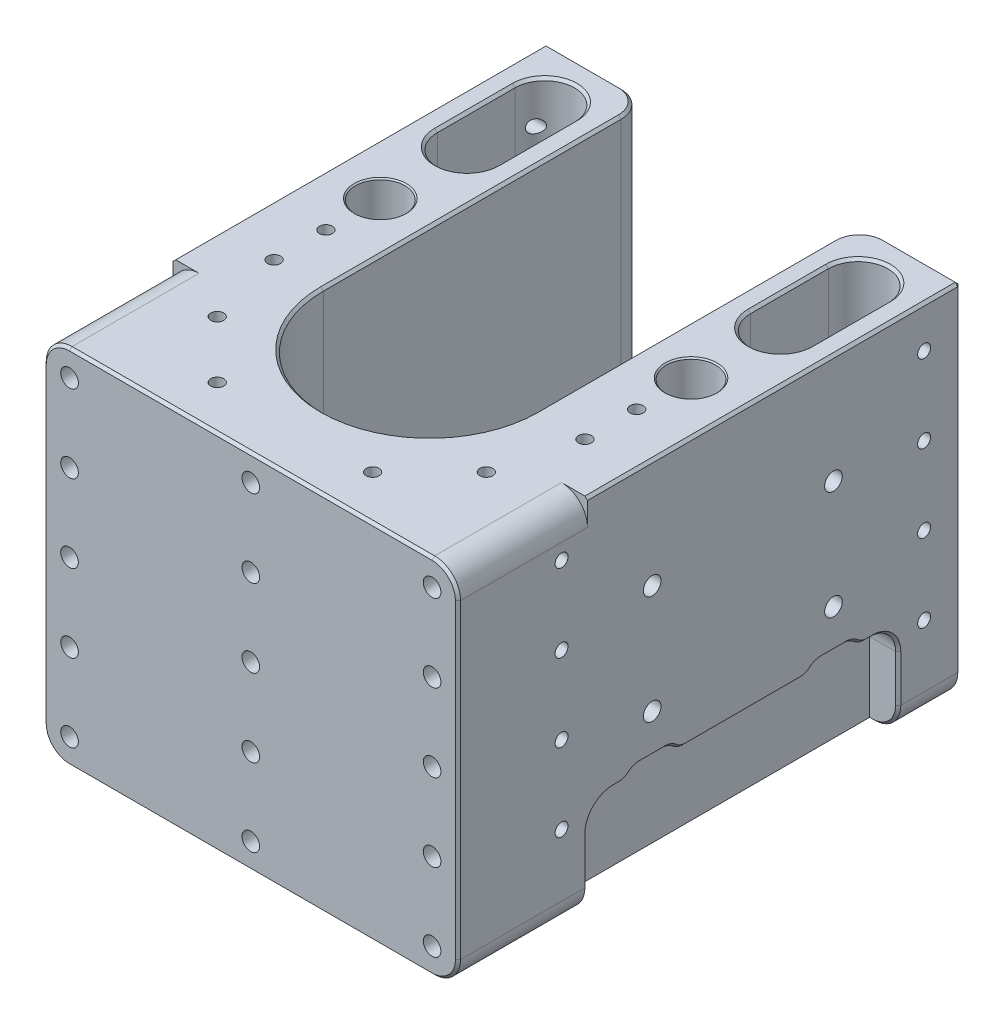
from build123d import *

# Parameters (mm, degrees)
BOSS_EXTRUDE1_DEPTH             = 140
SKETCH3_R                       = 9.55
CUT_EXTRUDE2_DEPTH              = 14.326
M8X1_25_TAPPED_HOLE1_AT_2_COUNT = 2
M8X1_25_TAPPED_HOLE1_AT_2_PITCH = 70
M8X1_25_TAPPED_HOLE1_AT_3_COUNT = 2
M8X1_25_TAPPED_HOLE1_AT_3_PITCH = 81.633326528
M8X1_25_TAPPED_HOLE1_AT_4_COUNT = 2
M8X1_25_TAPPED_HOLE1_AT_4_PITCH = 42
FILLET1_R                       = 10
SKETCH36_W                      = 33.761991249
SKETCH36_H                      = 120
SKETCH36_W_2                    = 53.52949171
CUT_EXTRUDE3_DEPTH              = 38
CBORE_FOR_M8_SHCS1_D            = 9
CBORE_FOR_M8_SHCS1_CBORE_D      = 15
CBORE_FOR_M8_SHCS1_CBORE_DEPTH  = 9
CHAMFER7_SIZE                   = 0.5
CHAMFER11_SIZE                  = 1
CHAMFER12_SIZE                  = 0.5
M6X1_0_TAPPED_HOLE1_D           = 5
M6X1_0_TAPPED_HOLE1_DEPTH       = 15
M6X1_0_TAPPED_HOLE1_CSINK_D     = 6.05
M6X1_0_TAPPED_HOLE1_CSINK_ANGLE = 90
M6X1_0_TAPPED_HOLE1_TIP         = 1.502151548
CUT_EXTRUDE4_DEPTH              = 25
FILLET2_R                       = 10
CUT_EXTRUDE5_DEPTH              = 50
FILLET3_R                       = 10
CHAMFER3_SIZE                   = 1
CHAMFER15_SIZE                  = 1
SKETCH55_W                      = 20
SKETCH55_H                      = 3
CUT_EXTRUDE6_DEPTH              = 227.296265988
FILLET4_R                       = 6
FILLET5_R                       = 6
CHAMFER16_SIZE                  = 1
M8X1_25_TAPPED_HOLE4_D          = 6.8
M8X1_25_TAPPED_HOLE4_DEPTH      = 20
M8X1_25_TAPPED_HOLE4_TIP        = 2.042926105
M6X1_0_TAPPED_HOLE2_D           = 5
M6X1_0_TAPPED_HOLE2_DEPTH       = 17
M6X1_0_TAPPED_HOLE2_TIP         = 1.502151548
M6X1_0_TAPPED_HOLE3_AT_2_COUNT  = 2
M6X1_0_TAPPED_HOLE3_AT_2_PITCH  = 30
M6X1_0_TAPPED_HOLE3_AT_3_COUNT  = 2
M6X1_0_TAPPED_HOLE3_AT_3_PITCH  = 60
M6X1_0_TAPPED_HOLE3_AT_4_COUNT  = 2
M6X1_0_TAPPED_HOLE3_AT_4_PITCH  = 90
M6X1_0_TAPPED_HOLE3_AT_5_COUNT  = 2
M6X1_0_TAPPED_HOLE3_AT_5_PITCH  = 140
M6X1_0_TAPPED_HOLE3_AT_6_COUNT  = 2
M6X1_0_TAPPED_HOLE3_AT_6_PITCH  = 143.178210633
M6X1_0_TAPPED_HOLE3_AT_7_COUNT  = 2
M6X1_0_TAPPED_HOLE3_AT_7_PITCH  = 152.315462117
M6X1_0_TAPPED_HOLE3_AT_8_COUNT  = 2
M6X1_0_TAPPED_HOLE3_AT_8_PITCH  = 166.433169771


# Read off the part's stored shape, not the designer's step: M8x1.25 Tapped Hole3
with BuildPart() as part:
    # Sketch1 → Boss-Extrude1 (new body)
    with BuildSketch(Plane(origin=(0, 0, 0), x_dir=(1, 0, 0), z_dir=(0, 1, 0))):
        with BuildLine():
            Line((41, 97), (80, 97))
            Line((80, 97), (80, -97))
            Line((80, -97), (-80, -97))
            Line((-80, -97), (-80, 97))
            Line((-80, 97), (-41, 97))
            Line((-41, 97), (-41, -28))
            ThreePointArc((-41, -28), (0, -69), (41, -28))
            Line((41, -28), (41, 97))
        make_face()
    extrude(amount=BOSS_EXTRUDE1_DEPTH)

    # Sketch3 → Cut-Extrude2 (cut)
    with BuildSketch(Plane(origin=(0, 140, 0), x_dir=(1, 0, 0), z_dir=(0, 1, 0))):
        with Locations(Location((-60, 13, 0), (0, 0, 270))):
            Circle(SKETCH3_R)
        with Locations(Location((60, 13, 0), (0, 0, 270))):
            Circle(SKETCH3_R)
    extrude(amount=-CUT_EXTRUDE2_DEPTH, mode=Mode.SUBTRACT)

    # Sketch10 → M8x1.25 Tapped Hole1 (revolve, cut)
    with BuildSketch(Plane(origin=(80, 56, -48), x_dir=(0, 0, -1), z_dir=(0, 1, 0))):
        Polygon((0, 0), (0, 32.042926105), (3.4, 30), (3.4, 0), align=None)
    m8x1_25_tapped_hole1 = revolve(axis=Axis((86.35, 56, -48), (-1, 0, 0)), mode=Mode.SUBTRACT)

    # M8x1.25 Tapped Hole1 at 2: M8x1.25 Tapped Hole1 ×2
    with Locations(*[(0, 0, i * M8X1_25_TAPPED_HOLE1_AT_2_PITCH) for i in range(1, M8X1_25_TAPPED_HOLE1_AT_2_COUNT)]):
        add(m8x1_25_tapped_hole1, mode=Mode.SUBTRACT)

    # M8x1.25 Tapped Hole1 at 3: M8x1.25 Tapped Hole1 ×2
    with Locations(*[Vector(0, 0.5144957554275263, 0.8574929257125443) * (i * M8X1_25_TAPPED_HOLE1_AT_3_PITCH) for i in range(1, M8X1_25_TAPPED_HOLE1_AT_3_COUNT)]):
        add(m8x1_25_tapped_hole1, mode=Mode.SUBTRACT)

    # M8x1.25 Tapped Hole1 at 4: M8x1.25 Tapped Hole1 ×2
    with Locations(*[(0, i * M8X1_25_TAPPED_HOLE1_AT_4_PITCH, 0) for i in range(1, M8X1_25_TAPPED_HOLE1_AT_4_COUNT)]):
        add(m8x1_25_tapped_hole1, mode=Mode.SUBTRACT)

    # Mirror2: M8x1.25 Tapped Hole1 across plane
    add(m8x1_25_tapped_hole1.mirror(Plane(origin=(0, 0, 0), x_dir=(0, 0, 1), z_dir=(1, 0, 0))), mode=Mode.SUBTRACT)

    # Mirror2 copy 1 sketch → Mirror2 copy 1 (revolve, cut)
    with BuildSketch(Plane(origin=(-80, 56, 22), x_dir=(0, 0, -1), z_dir=(0, 1, 0))):
        Polygon((0, 0), (0, -32.042926105), (3.4, -30), (3.4, 0), align=None)
    revolve(axis=Axis((-86.35, 56, 22), (-1, 0, 0)), mode=Mode.SUBTRACT)

    # Mirror2 copy 2 sketch → Mirror2 copy 2 (revolve, cut)
    with BuildSketch(Plane(origin=(-80, 98, 22), x_dir=(0, 0, -1), z_dir=(0, 1, 0))):
        Polygon((0, 0), (0, -32.042926105), (3.4, -30), (3.4, 0), align=None)
    revolve(axis=Axis((-86.35, 98, 22), (-1, 0, 0)), mode=Mode.SUBTRACT)

    # Mirror2 copy 3 sketch → Mirror2 copy 3 (revolve, cut)
    with BuildSketch(Plane(origin=(-80, 98, -48), x_dir=(0, 0, -1), z_dir=(0, 1, 0))):
        Polygon((0, 0), (0, -32.042926105), (3.4, -30), (3.4, 0), align=None)
    revolve(axis=Axis((-86.35, 98, -48), (-1, 0, 0)), mode=Mode.SUBTRACT)

    # Fillet1
    fillet1_edges = [part.edges().sort_by_distance(p)[0] for p in [
        (-41, 70, -97),
        (41, 70, -97),
    ]]
    fillet(fillet1_edges, radius=FILLET1_R)

    # Sketch36 → Cut-Extrude3 (cut)
    with BuildSketch(Plane(origin=(0, 0, 0), x_dir=(1, 0, 0), z_dir=(0, 1, 0))):
        with Locations((-85.880995625, 13)):
            Rectangle(SKETCH36_W, SKETCH36_H)
        with Locations((95.764745855, 13)):
            Rectangle(SKETCH36_W_2, SKETCH36_H)
    extrude(amount=CUT_EXTRUDE3_DEPTH, mode=Mode.SUBTRACT)

    # CBORE for M8 SHCS1 (through all)
    with Locations(Plane(origin=(0, 0, 0), x_dir=(-1, 0, 0), z_dir=(0, -1, 0))):
        with Locations((60, 13), (-60, 13)):
            CounterBoreHole(CBORE_FOR_M8_SHCS1_D / 2, CBORE_FOR_M8_SHCS1_CBORE_D / 2, CBORE_FOR_M8_SHCS1_CBORE_DEPTH)

    # Chamfer7
    chamfer7_edges = [part.edges().sort_by_distance(p)[0] for p in [
        (-60, 140, -22.55),
        (60, 140, -22.55),
    ]]
    chamfer(chamfer7_edges, length=CHAMFER7_SIZE)

    # Chamfer11
    chamfer11_edges = [part.edges().sort_by_distance(p)[0] for p in [
        (67.5, 0, -13),
        (-52.5, 0, -13),
    ]]
    chamfer(chamfer11_edges, length=CHAMFER11_SIZE)

    # Chamfer12
    chamfer12_edges = [part.edges().sort_by_distance(p)[0] for p in [
        (55.5, 125.674, -13),
        (55.5, 9, -13),
        (-64.5, 125.674, -13),
        (-64.5, 9, -13),
    ]]
    chamfer(chamfer12_edges, length=CHAMFER12_SIZE)

    # M8x1.25 Tapped Hole3 outline → M8x1.25 Tapped Hole3 (revolve, cut)
    with BuildSketch(Plane(origin=(-54, 0, 62.5), x_dir=(1, 0, 0), z_dir=(0, 0, 1))):
        Polygon((3.4, 20), (0, 22.042926105), (0, 0), (4.3, 0), (3.4, 0.9), align=None)
    revolve(axis=Axis((-54, 0, 62.5), (0, 1, 0)), mode=Mode.SUBTRACT)

    # M8x1.25 Tapped Hole3 2 outline → M8x1.25 Tapped Hole3 2 (revolve, cut)
    with BuildSketch(Plane(origin=(54, 0, 62.5), x_dir=(1, 0, 0), z_dir=(0, 0, 1))):
        Polygon((3.4, 20), (0, 22.042926105), (0, 0), (4.3, 0), (3.4, 0.9), align=None)
    revolve(axis=Axis((54, 0, 62.5), (0, 1, 0)), mode=Mode.SUBTRACT)

    # M8x1.25 Tapped Hole3 3 outline → M8x1.25 Tapped Hole3 3 (revolve, cut)
    with BuildSketch(Plane(origin=(54, 0, 32.5), x_dir=(1, 0, 0), z_dir=(0, 0, 1))):
        Polygon((3.4, 20), (0, 22.042926105), (0, 0), (4.3, 0), (3.4, 0.9), align=None)
    revolve(axis=Axis((54, 0, 32.5), (0, 1, 0)), mode=Mode.SUBTRACT)

    # M8x1.25 Tapped Hole3 4 outline → M8x1.25 Tapped Hole3 4 (revolve, cut)
    with BuildSketch(Plane(origin=(54, 0, 2.5), x_dir=(1, 0, 0), z_dir=(0, 0, 1))):
        Polygon((3.4, 20), (0, 22.042926105), (0, 0), (4.3, 0), (3.4, 0.9), align=None)
    revolve(axis=Axis((54, 0, 2.5), (0, 1, 0)), mode=Mode.SUBTRACT)

    # M8x1.25 Tapped Hole3 5 outline → M8x1.25 Tapped Hole3 5 (revolve, cut)
    with BuildSketch(Plane(origin=(54, 0, -27.5), x_dir=(1, 0, 0), z_dir=(0, 0, 1))):
        Polygon((3.4, 20), (0, 22.042926105), (0, 0), (4.3, 0), (3.4, 0.9), align=None)
    revolve(axis=Axis((54, 0, -27.5), (0, 1, 0)), mode=Mode.SUBTRACT)

    # M8x1.25 Tapped Hole3 6 outline → M8x1.25 Tapped Hole3 6 (revolve, cut)
    with BuildSketch(Plane(origin=(54, 0, -57.5), x_dir=(1, 0, 0), z_dir=(0, 0, 1))):
        Polygon((3.4, 20), (0, 22.042926105), (0, 0), (4.3, 0), (3.4, 0.9), align=None)
    revolve(axis=Axis((54, 0, -57.5), (0, 1, 0)), mode=Mode.SUBTRACT)

    # M8x1.25 Tapped Hole3 7 outline → M8x1.25 Tapped Hole3 7 (revolve, cut)
    with BuildSketch(Plane(origin=(-54, 0, 32.5), x_dir=(1, 0, 0), z_dir=(0, 0, 1))):
        Polygon((3.4, 20), (0, 22.042926105), (0, 0), (4.3, 0), (3.4, 0.9), align=None)
    revolve(axis=Axis((-54, 0, 32.5), (0, 1, 0)), mode=Mode.SUBTRACT)

    # M8x1.25 Tapped Hole3 8 outline → M8x1.25 Tapped Hole3 8 (revolve, cut)
    with BuildSketch(Plane(origin=(-54, 0, 2.5), x_dir=(1, 0, 0), z_dir=(0, 0, 1))):
        Polygon((3.4, 20), (0, 22.042926105), (0, 0), (4.3, 0), (3.4, 0.9), align=None)
    revolve(axis=Axis((-54, 0, 2.5), (0, 1, 0)), mode=Mode.SUBTRACT)

    # M8x1.25 Tapped Hole3 9 outline → M8x1.25 Tapped Hole3 9 (revolve, cut)
    with BuildSketch(Plane(origin=(-54, 0, -27.5), x_dir=(1, 0, 0), z_dir=(0, 0, 1))):
        Polygon((3.4, 20), (0, 22.042926105), (0, 0), (4.3, 0), (3.4, 0.9), align=None)
    revolve(axis=Axis((-54, 0, -27.5), (0, 1, 0)), mode=Mode.SUBTRACT)

    # M8x1.25 Tapped Hole3 10 outline → M8x1.25 Tapped Hole3 10 (revolve, cut)
    with BuildSketch(Plane(origin=(-54, 0, -57.5), x_dir=(1, 0, 0), z_dir=(0, 0, 1))):
        Polygon((3.4, 20), (0, 22.042926105), (0, 0), (4.3, 0), (3.4, 0.9), align=None)
    revolve(axis=Axis((-54, 0, -57.5), (0, 1, 0)), mode=Mode.SUBTRACT)

    # M6x1.0 Tapped Hole1
    with Locations(Plane(origin=(0, 0, 0), x_dir=(-1, 0, 0), z_dir=(0, -1, 0))):
        with Locations((-60, -85), (-20, -85), (20, -85), (60, -85)):
            CounterSinkHole(M6X1_0_TAPPED_HOLE1_D / 2, M6X1_0_TAPPED_HOLE1_CSINK_D / 2, depth=M6X1_0_TAPPED_HOLE1_DEPTH, counter_sink_angle=M6X1_0_TAPPED_HOLE1_CSINK_ANGLE)
            with Locations((0, 0, -(M6X1_0_TAPPED_HOLE1_DEPTH + M6X1_0_TAPPED_HOLE1_TIP / 2))):  # 118° drill point
                Cone(0, M6X1_0_TAPPED_HOLE1_D / 2, M6X1_0_TAPPED_HOLE1_TIP, mode=Mode.SUBTRACT)

    # Sketch45 → Cut-Extrude4 (cut)
    with BuildSketch(Plane(origin=(0, 140, 0), x_dir=(1, 0, 0), z_dir=(0, 1, 0))):
        with BuildLine():
            Line((-72, 47), (-72, 77))
            ThreePointArc((-72, 77), (-60.5, 88.5), (-49, 77))
            Line((-49, 77), (-49, 47))
            ThreePointArc((-49, 47), (-60.5, 35.5), (-72, 47))
        make_face()
    cut_extrude4 = extrude(amount=-CUT_EXTRUDE4_DEPTH, mode=Mode.SUBTRACT)

    # Mirror3: Cut-Extrude4 across plane
    add(cut_extrude4.mirror(Plane(origin=(0, 0, 0), x_dir=(0, 0, 1), z_dir=(1, 0, 0))), mode=Mode.SUBTRACT)

    # Fillet2
    fillet2_edges = [part.edges().sort_by_distance(p)[0] for p in [
        (74.5, 38, -73),
        (74.5, 38, 47),
        (-74.5, 38, -73),
        (-74.5, 38, 47),
    ]]
    fillet(fillet2_edges, radius=FILLET2_R)

    # Sketch46 → Cut-Extrude5 (cut)
    with BuildSketch(Plane.XY.offset(97)):
        with BuildLine():
            Line((70, 140), (80, 140))
            Line((80, 140), (80, 130))
            ThreePointArc((80, 130), (77.071067812, 137.071067812), (70, 140))
        make_face()
    cut_extrude5 = extrude(amount=-CUT_EXTRUDE5_DEPTH, mode=Mode.SUBTRACT)

    # Mirror4: Cut-Extrude5 across plane
    add(cut_extrude5.mirror(Plane(origin=(0, 0, 0), x_dir=(0, 0, 1), z_dir=(1, 0, 0))), mode=Mode.SUBTRACT)

    # Fillet3
    fillet3_edges = [part.edges().sort_by_distance(p)[0] for p in [
        (80, 0, 72),
        (80, 0, -85),
        (-80, 0, 72),
        (-80, 0, -85),
    ]]
    fillet(fillet3_edges, radius=FILLET3_R)

    # Chamfer3
    chamfer3_edges = [part.edges().sort_by_distance(p)[0] for p in [
        (0, 0, 69),
        (-80, 75, -97),
        (80, 75, -97),
        (0, 140, 69),
        (-41, 140, -29.5),
        (-80, 140, -25),
        (80, 70, 97),
        (80, 140, -25),
        (77.071067812, 137.071067812, 97),
        (0, 140, 97),
        (-80, 70, 97),
        (-77.071067812, 137.071067812, 97),
        (60.5, 0, -97),
        (0, 0, 97),
        (-77.071067812, 2.928932188, -97),
        (77.071067812, 2.928932188, -97),
        (-77.071067812, 2.928932188, 97),
        (77.071067812, 2.928932188, 97),
        (41, 0, -29.5),
        (41, 140, -29.5),
        (-60.5, 0, -97),
        (-43.928932188, 0, -94.071067812),
        (43.928932188, 0, -94.071067812),
        (-65.5, 140, -97),
        (-43.928932188, 140, -94.071067812),
        (43.928932188, 140, -94.071067812),
        (65.5, 140, -97),
        (-41, 0, -29.5),
    ]]
    chamfer(chamfer3_edges, length=CHAMFER3_SIZE)

    # Chamfer15
    chamfer15_edges = [part.edges().sort_by_distance(p)[0] for p in [
        (-60.5, 140, -35.5),
        (-49, 140, -62),
        (-60.5, 140, -88.5),
        (-72, 140, -62),
        (60.5, 140, -35.5),
        (49, 140, -62),
        (60.5, 140, -88.5),
        (72, 140, -62),
    ]]
    chamfer(chamfer15_edges, length=CHAMFER15_SIZE)

    # Sketch55 → Cut-Extrude6 (cut, through all)
    with BuildSketch(Plane(origin=(69, 0, 0), x_dir=(0, 0, -1), z_dir=(1, 0, 0))):
        with Locations((-22, 39.5)):
            Rectangle(SKETCH55_W, SKETCH55_H)
        with Locations((48, 39.5)):
            Rectangle(SKETCH55_W, SKETCH55_H)
    cut_extrude6 = extrude(amount=CUT_EXTRUDE6_DEPTH, mode=Mode.SUBTRACT)

    # Mirror6: Cut-Extrude6 across plane
    add(cut_extrude6.mirror(Plane(origin=(0, 0, 0), x_dir=(0, 0, 1), z_dir=(1, 0, 0))), mode=Mode.SUBTRACT)

    # Fillet4
    # the kernel refuses this fillet: 6 mm, written as the material it adds along each edge
    with BuildSketch(Plane(origin=(56.009618943, 41, -58), x_dir=(0, -1, 0), z_dir=(1, 0, 0)), Plane(origin=(56.009618943, 41, 12), x_dir=(0, -1, 0), z_dir=(1, 0, 0)), Plane(origin=(-56.009618943, 41, -38), x_dir=(0, -1, 0), z_dir=(-1, 0, 0)), Plane(origin=(-56.009618943, 41, 32), x_dir=(0, -1, 0), z_dir=(-1, 0, 0))) as fillet4_piece_1:
        with BuildLine():
            CenterArc((6, -5.196152423), FILLET4_R, 120, 60)
            Line((0, -5.196152423), (-0.12, -5.196152423))
            Line((-0.12, -5.196152423), (-0.12, 0))
            Line((-0.12, 0), (0, 0.12))
            ThreePointArc((0, 0.12), (1.5, 0.12), (2.94, 0.103923048))
            Line((2.94, 0.103923048), (3, 0))
        make_face()
    extrude(amount=23.990381057)
    with BuildSketch(Plane(origin=(56.009618943, 41, -38), x_dir=(0, 0, -1), z_dir=(1, 0, 0)), Plane(origin=(56.009618943, 41, 32), x_dir=(0, 0, -1), z_dir=(1, 0, 0)), Plane(origin=(-56.009618943, 41, -58), x_dir=(0, 0, 1), z_dir=(-1, 0, 0)), Plane(origin=(-56.009618943, 41, 12), x_dir=(0, 0, 1), z_dir=(-1, 0, 0))) as fillet4_piece_2:
        with BuildLine():
            CenterArc((5.196152423, -6), FILLET4_R, 90, 60)
            Line((0, -3), (-0.103923048, -2.94))
            ThreePointArc((-0.103923048, -2.94), (-0.12, -1.5), (-0.12, 0))
            Line((-0.12, 0), (0, 0.12))
            Line((0, 0.12), (5.196152423, 0.12))
            Line((5.196152423, 0.12), (5.196152423, 0))
        make_face()
    extrude(amount=23.990381057)

    # Fillet5
    fillet5_edges = [part.edges().sort_by_distance(p)[0] for p in [
        (74.5, 38, 32),
        (74.5, 38, 12),
        (74.5, 38, -38),
        (74.5, 38, -58),
        (-74.5, 38, 12),
        (-74.5, 38, 32),
        (-74.5, 38, -58),
        (-74.5, 38, -38),
    ]]
    fillet(fillet5_edges, radius=FILLET5_R)

    # Chamfer16
    # the kernel refuses this chamfer: 1 mm, written as the material it takes off along each edge
    with BuildSketch(Plane(origin=(69, 0, 47), x_dir=(0, 0.9996219169112968, -0.027495876610589075), z_dir=(1, 0, 0)), Plane(origin=(70, 0, -73), x_dir=(0, 0.999621916911297, 0.02749587661058218), z_dir=(-1, 0, 0)), Plane(origin=(-69, 0, 47), x_dir=(0, -0.027495876610586292, 0.9996219169112968), z_dir=(-1, 0, 0)), Plane(origin=(-70, 0, -73), x_dir=(0, -0.027495876610586483, -0.9996219169112968), z_dir=(1, 0, 0))) as chamfer16_piece_1:
        Polygon((CHAMFER16_SIZE * 0.999621916911, CHAMFER16_SIZE * 0.0274958766106), (-CHAMFER16_SIZE * 0.0274958766106, CHAMFER16_SIZE * 0.999621916911), (0, 0), align=None)
    extrude(amount=1, mode=Mode.SUBTRACT)
    with BuildSketch(Plane(origin=(69, 0, -73), x_dir=(0.027495876610582174, 0.9996219169112968, 0), z_dir=(0, 0, 1)), Plane(origin=(-69, 0, -73), x_dir=(0.9996219169112968, -0.027495876610586483, 0), z_dir=(0, 0, 1))) as chamfer16_piece_2:
        Polygon((CHAMFER16_SIZE * 0.999621916911, CHAMFER16_SIZE * 0.0274958766106), (-CHAMFER16_SIZE * 0.0274958766106, CHAMFER16_SIZE * 0.999621916911), (0, 0), align=None)
    extrude(amount=120, mode=Mode.SUBTRACT)
    with BuildSketch(Plane(origin=(80, 10, 47), x_dir=(0.027495876610582105, 0, 0.999621916911297), z_dir=(0, 1, 0)), Plane(origin=(-80, 28, -73), x_dir=(0.999621916911297, 0, 0.027495876610582292), z_dir=(0, -1, 0)), Plane(origin=(-80, 10, 47), x_dir=(0.9996219169112968, 0, -0.027495876610589196), z_dir=(0, 1, 0)), Plane(origin=(80, 28, -73), x_dir=(0.02749587661058229, 0, -0.9996219169112968), z_dir=(0, -1, 0))) as chamfer16_piece_3:
        Polygon((CHAMFER16_SIZE * 0.999621916911, -CHAMFER16_SIZE * 0.0274958766106), (-CHAMFER16_SIZE * 0.0274958766106, -CHAMFER16_SIZE * 0.999621916911), (0, 0), align=None)
    extrude(amount=18, mode=Mode.SUBTRACT)
    with BuildSketch(Plane(origin=(80, 38, -63), x_dir=(0.027495876610582105, 0.999621916911297, 0), z_dir=(0, 0, 1)), Plane(origin=(80, 38, 34.74110151), x_dir=(0.027495876610582105, 0.999621916911297, 0), z_dir=(0, 0, 1))) as chamfer16_piece_4:
        Polygon((CHAMFER16_SIZE * 0.999621916911, CHAMFER16_SIZE * 0.0274958766106), (-CHAMFER16_SIZE * 0.0274958766106, CHAMFER16_SIZE * 0.999621916911), (0, 0), align=None)
    extrude(amount=2.25889849, mode=Mode.SUBTRACT)
    with BuildSketch(Plane(origin=(-80, 38, -63), x_dir=(-0.027495876610582105, 0.999621916911297, 0), z_dir=(0, 0, 1)), Plane(origin=(-80, 38, 34.74110151), x_dir=(-0.027495876610582105, 0.999621916911297, 0), z_dir=(0, 0, 1))) as chamfer16_piece_5:
        Polygon((CHAMFER16_SIZE * 0.999621916911, -CHAMFER16_SIZE * 0.0274958766106), (-CHAMFER16_SIZE * 0.0274958766106, -CHAMFER16_SIZE * 0.999621916911), (0, 0), align=None)
    extrude(amount=2.25889849, mode=Mode.SUBTRACT)
    with BuildSketch(Plane(origin=(80, 28, 37), x_dir=(0, 0, 1), z_dir=(0, -1, 0))) as chamfer16_piece_6:
        Polygon((10 + CHAMFER16_SIZE, 0), (10, CHAMFER16_SIZE), (10, 0), align=None)
    revolve(axis=Axis((80, 28, 37), (-1, 0, 0)), revolution_arc=90, mode=Mode.SUBTRACT)
    with BuildSketch(Plane(origin=(80, 28, -63), x_dir=(0, 0, -1), z_dir=(0, -1, 0))) as chamfer16_piece_7:
        Polygon((10 + CHAMFER16_SIZE, 0), (10, -CHAMFER16_SIZE), (10, 0), align=None)
    revolve(axis=Axis((80, 28, -63), (1, 0, 0)), revolution_arc=90, mode=Mode.SUBTRACT)
    with BuildSketch(Plane(origin=(-80, 28, 37), x_dir=(0, 0, 1), z_dir=(0, -1, 0))) as chamfer16_piece_8:
        Polygon((10 + CHAMFER16_SIZE, 0), (10, -CHAMFER16_SIZE), (10, 0), align=None)
    revolve(axis=Axis((-80, 28, 37), (-1, 0, 0)), revolution_arc=90, mode=Mode.SUBTRACT)
    with BuildSketch(Plane(origin=(-80, 28, -63), x_dir=(0, 0, -1), z_dir=(0, -1, 0))) as chamfer16_piece_9:
        Polygon((10 + CHAMFER16_SIZE, 0), (10, CHAMFER16_SIZE), (10, 0), align=None)
    revolve(axis=Axis((-80, 28, -63), (1, 0, 0)), revolution_arc=90, mode=Mode.SUBTRACT)
    with BuildSketch(Plane(origin=(-70, 10, -73), x_dir=(0, -1, 0), z_dir=(1, 0, 0))) as chamfer16_piece_10:
        Polygon((10, CHAMFER16_SIZE), (10 - CHAMFER16_SIZE, 0), (10, 0), align=None)
    revolve(axis=Axis((-70, 10, -73), (0, 0, -1)), revolution_arc=90, mode=Mode.SUBTRACT)
    with BuildSketch(Plane(origin=(70, 10, -73), x_dir=(1, 0, 0), z_dir=(0, 1, 0))) as chamfer16_piece_11:
        Polygon((10 - CHAMFER16_SIZE, 0), (10, CHAMFER16_SIZE), (10, 0), align=None)
    revolve(axis=Axis((70, 10, -73), (0, 0, -1)), revolution_arc=90, mode=Mode.SUBTRACT)
    with BuildSketch(Plane(origin=(70, 10, 47), x_dir=(1, 0, 0), z_dir=(0, 1, 0))) as chamfer16_piece_12:
        Polygon((10 - CHAMFER16_SIZE, 0), (10, -CHAMFER16_SIZE), (10, 0), align=None)
    revolve(axis=Axis((70, 10, 47), (0, 0, -1)), revolution_arc=90, mode=Mode.SUBTRACT)
    with BuildSketch(Plane(origin=(-70, 10, 47), x_dir=(0, -1, 0), z_dir=(1, 0, 0))) as chamfer16_piece_13:
        Polygon((10, -CHAMFER16_SIZE), (10 - CHAMFER16_SIZE, 0), (10, 0), align=None)
    revolve(axis=Axis((-70, 10, 47), (0, 0, -1)), revolution_arc=90, mode=Mode.SUBTRACT)
    with BuildSketch(Plane(origin=(-80, 41, -43.196152423), x_dir=(-0.027495876610582105, 0.999621916911297, 0), z_dir=(0, 0, -1)), Plane(origin=(-80, 41, 26.803847577), x_dir=(-0.027495876610582105, 0.999621916911297, 0), z_dir=(0, 0, -1))) as chamfer16_piece_14:
        Polygon((CHAMFER16_SIZE * 0.999621916911, CHAMFER16_SIZE * 0.0274958766106), (-CHAMFER16_SIZE * 0.0274958766106, CHAMFER16_SIZE * 0.999621916911), (0, 0), align=None)
    extrude(amount=9.607695155, mode=Mode.SUBTRACT)
    with BuildSketch(Plane(origin=(80, 41, -43.196152423), x_dir=(0.027495876610582105, 0.999621916911297, 0), z_dir=(0, 0, -1)), Plane(origin=(80, 41, 26.803847577), x_dir=(0.027495876610582105, 0.999621916911297, 0), z_dir=(0, 0, -1))) as chamfer16_piece_15:
        Polygon((CHAMFER16_SIZE * 0.999621916911, -CHAMFER16_SIZE * 0.0274958766106), (-CHAMFER16_SIZE * 0.0274958766106, -CHAMFER16_SIZE * 0.999621916911), (0, 0), align=None)
    extrude(amount=9.607695155, mode=Mode.SUBTRACT)
    with BuildSketch(Plane(origin=(-80, 35, -43.196152423), x_dir=(0, 0.7499999999999988, 0.6614378277661489), z_dir=(0, -0.6614378277661489, 0.7499999999999988))) as chamfer16_piece_16:
        Polygon((6 + CHAMFER16_SIZE, 0), (6, -CHAMFER16_SIZE), (6, 0), align=None)
    revolve(axis=Axis((-80, 35, -43.196152423), (-1, 0, 0)), revolution_arc=41.409622109, mode=Mode.SUBTRACT)
    with BuildSketch(Plane(origin=(-80, 35, 26.803847577), x_dir=(0, 0.7499999999999997, 0.661437827766148), z_dir=(0, -0.661437827766148, 0.7499999999999997))) as chamfer16_piece_17:
        Polygon((6 + CHAMFER16_SIZE, 0), (6, -CHAMFER16_SIZE), (6, 0), align=None)
    revolve(axis=Axis((-80, 35, 26.803847577), (-1, 0, 0)), revolution_arc=41.409622109, mode=Mode.SUBTRACT)
    with BuildSketch(Plane(origin=(80, 35, -52.803847577), x_dir=(0, 0.7499999999999999, -0.6614378277661477), z_dir=(0, -0.6614378277661477, -0.7499999999999999))) as chamfer16_piece_18:
        Polygon((6 + CHAMFER16_SIZE, 0), (6, -CHAMFER16_SIZE), (6, 0), align=None)
    revolve(axis=Axis((80, 35, -52.803847577), (1, 0, 0)), revolution_arc=41.409622109, mode=Mode.SUBTRACT)
    with BuildSketch(Plane(origin=(80, 35, 17.196152423), x_dir=(0, 0.7499999999999997, -0.661437827766148), z_dir=(0, -0.661437827766148, -0.7499999999999997))) as chamfer16_piece_19:
        Polygon((6 + CHAMFER16_SIZE, 0), (6, -CHAMFER16_SIZE), (6, 0), align=None)
    revolve(axis=Axis((80, 35, 17.196152423), (1, 0, 0)), revolution_arc=41.409622109, mode=Mode.SUBTRACT)
    with BuildSketch(Plane(origin=(-80, 35, -52.803847577), x_dir=(0, 1, 0), z_dir=(0, 0, 1))) as chamfer16_piece_20:
        Polygon((6 + CHAMFER16_SIZE, 0), (6, -CHAMFER16_SIZE), (6, 0), align=None)
    revolve(axis=Axis((-80, 35, -52.803847577), (-1, 0, 0)), revolution_arc=41.409622109, mode=Mode.SUBTRACT)
    with BuildSketch(Plane(origin=(-80, 38, -35.25889849), x_dir=(-0.027495876610582105, 0.999621916911297, 0), z_dir=(0, 0, 1))) as chamfer16_piece_21:
        Polygon((CHAMFER16_SIZE * 0.999621916911, -CHAMFER16_SIZE * 0.0274958766106), (-CHAMFER16_SIZE * 0.0274958766106, -CHAMFER16_SIZE * 0.999621916911), (0, 0), align=None)
    extrude(amount=44.517796979, mode=Mode.SUBTRACT)
    with BuildSketch(Plane(origin=(-80, 35, 17.196152423), x_dir=(0, 1, 0), z_dir=(0, 0, 1))) as chamfer16_piece_22:
        Polygon((6 + CHAMFER16_SIZE, 0), (6, -CHAMFER16_SIZE), (6, 0), align=None)
    revolve(axis=Axis((-80, 35, 17.196152423), (-1, 0, 0)), revolution_arc=41.409622109, mode=Mode.SUBTRACT)
    with BuildSketch(Plane(origin=(-80, 44, 34.74110151), x_dir=(0, -1, 0), z_dir=(0, 0, 1))) as chamfer16_piece_23:
        Polygon((6 - CHAMFER16_SIZE, 0), (6, CHAMFER16_SIZE), (6, 0), align=None)
    revolve(axis=Axis((-80, 44, 34.74110151), (1, 0, 0)), revolution_arc=41.409622109, mode=Mode.SUBTRACT)
    with BuildSketch(Plane(origin=(-80, 44, 9.25889849), x_dir=(0, -0.7499999999999999, 0.6614378277661477), z_dir=(0, 0.6614378277661477, 0.7499999999999999))) as chamfer16_piece_24:
        Polygon((6 - CHAMFER16_SIZE, 0), (6, CHAMFER16_SIZE), (6, 0), align=None)
    revolve(axis=Axis((-80, 44, 9.25889849), (1, 0, 0)), revolution_arc=41.409622109, mode=Mode.SUBTRACT)
    with BuildSketch(Plane(origin=(-80, 44, -35.25889849), x_dir=(0, -1, 0), z_dir=(0, 0, 1))) as chamfer16_piece_25:
        Polygon((6 - CHAMFER16_SIZE, 0), (6, CHAMFER16_SIZE), (6, 0), align=None)
    revolve(axis=Axis((-80, 44, -35.25889849), (1, 0, 0)), revolution_arc=41.409622109, mode=Mode.SUBTRACT)
    with BuildSketch(Plane(origin=(-80, 44, -60.74110151), x_dir=(0, -0.7499999999999993, 0.6614378277661483), z_dir=(0, 0.6614378277661483, 0.7499999999999993))) as chamfer16_piece_26:
        Polygon((6 - CHAMFER16_SIZE, 0), (6, CHAMFER16_SIZE), (6, 0), align=None)
    revolve(axis=Axis((-80, 44, -60.74110151), (1, 0, 0)), revolution_arc=41.409622109, mode=Mode.SUBTRACT)
    with BuildSketch(Plane(origin=(80, 38, -35.25889849), x_dir=(0.027495876610582105, 0.999621916911297, 0), z_dir=(0, 0, 1))) as chamfer16_piece_27:
        Polygon((CHAMFER16_SIZE * 0.999621916911, CHAMFER16_SIZE * 0.0274958766106), (-CHAMFER16_SIZE * 0.0274958766106, CHAMFER16_SIZE * 0.999621916911), (0, 0), align=None)
    extrude(amount=44.517796979, mode=Mode.SUBTRACT)
    with BuildSketch(Plane(origin=(80, 35, -43.196152423), x_dir=(0, 1, 0), z_dir=(0, 0, -1))) as chamfer16_piece_28:
        Polygon((6 + CHAMFER16_SIZE, 0), (6, -CHAMFER16_SIZE), (6, 0), align=None)
    revolve(axis=Axis((80, 35, -43.196152423), (1, 0, 0)), revolution_arc=41.409622109, mode=Mode.SUBTRACT)
    with BuildSketch(Plane(origin=(80, 35, 26.803847577), x_dir=(0, 1, 0), z_dir=(0, 0, -1))) as chamfer16_piece_29:
        Polygon((6 + CHAMFER16_SIZE, 0), (6, -CHAMFER16_SIZE), (6, 0), align=None)
    revolve(axis=Axis((80, 35, 26.803847577), (1, 0, 0)), revolution_arc=41.409622109, mode=Mode.SUBTRACT)
    with BuildSketch(Plane(origin=(80, 44, 34.74110151), x_dir=(0, -1, 0), z_dir=(0, 0, 1))) as chamfer16_piece_30:
        Polygon((6 - CHAMFER16_SIZE, 0), (6, -CHAMFER16_SIZE), (6, 0), align=None)
    revolve(axis=Axis((80, 44, 34.74110151), (1, 0, 0)), revolution_arc=41.409622109, mode=Mode.SUBTRACT)
    with BuildSketch(Plane(origin=(80, 44, 9.25889849), x_dir=(0, -1, 0), z_dir=(0, 0, -1))) as chamfer16_piece_31:
        Polygon((6 - CHAMFER16_SIZE, 0), (6, CHAMFER16_SIZE), (6, 0), align=None)
    revolve(axis=Axis((80, 44, 9.25889849), (-1, 0, 0)), revolution_arc=41.409622109, mode=Mode.SUBTRACT)
    with BuildSketch(Plane(origin=(80, 44, -35.25889849), x_dir=(0, -0.7499999999999999, -0.6614378277661477), z_dir=(0, 0.6614378277661477, -0.7499999999999999))) as chamfer16_piece_32:
        Polygon((6 - CHAMFER16_SIZE, 0), (6, CHAMFER16_SIZE), (6, 0), align=None)
    revolve(axis=Axis((80, 44, -35.25889849), (-1, 0, 0)), revolution_arc=41.409622109, mode=Mode.SUBTRACT)
    with BuildSketch(Plane(origin=(80, 44, -60.74110151), x_dir=(0, -0.7499999999999999, 0.6614378277661477), z_dir=(0, 0.6614378277661477, 0.7499999999999999))) as chamfer16_piece_33:
        Polygon((6 - CHAMFER16_SIZE, 0), (6, -CHAMFER16_SIZE), (6, 0), align=None)
    revolve(axis=Axis((80, 44, -60.74110151), (1, 0, 0)), revolution_arc=41.409622109, mode=Mode.SUBTRACT)
    with BuildSketch(Plane(origin=(66.428317012, 0, 47), x_dir=(0, 0.9996219169112968, -0.027495876610589075), z_dir=(1, 0, 0))) as chamfer16_piece_34a_section:
        Polygon((CHAMFER16_SIZE * 0.999621916911, CHAMFER16_SIZE * 0.0274958766106), (-CHAMFER16_SIZE * 0.0274958766106, CHAMFER16_SIZE * 0.999621916911), (0, 0), align=None)
    chamfer16_piece_34a = extrude(amount=3.571682988, mode=Mode.PRIVATE)
    chamfer16_piece_34a = split(chamfer16_piece_34a, bisect_by=Plane(origin=(69, 0.329793627, 47.329793627), z_dir=(-1, 0, 0)), keep=Keep.TOP, mode=Mode.PRIVATE)
    with BuildSketch(Plane(origin=(69, 0, -73), x_dir=(0.027495876610582174, 0.9996219169112968, 0), z_dir=(0, 0, 1))) as chamfer16_piece_34b_section:
        Polygon((CHAMFER16_SIZE * 0.999621916911, CHAMFER16_SIZE * 0.0274958766106), (-CHAMFER16_SIZE * 0.0274958766106, CHAMFER16_SIZE * 0.999621916911), (0, 0), align=None)
    chamfer16_piece_34b = extrude(amount=122.571682988, mode=Mode.PRIVATE)
    chamfer16_piece_34b = split(chamfer16_piece_34b, bisect_by=Plane(origin=(68.670206373, 0.329793627, 47), z_dir=(0, 0, 1)), keep=Keep.TOP, mode=Mode.PRIVATE)
    chamfer16_piece_34 = chamfer16_piece_34a & chamfer16_piece_34b
    add(chamfer16_piece_34, mode=Mode.SUBTRACT)
    with BuildSketch(Plane(origin=(70, 0, -73), x_dir=(0, 0.999621916911297, 0.02749587661058218), z_dir=(-1, 0, 0))) as chamfer16_piece_35a_section:
        Polygon((CHAMFER16_SIZE * 0.999621916911, CHAMFER16_SIZE * 0.0274958766106), (-CHAMFER16_SIZE * 0.0274958766106, CHAMFER16_SIZE * 0.999621916911), (0, 0), align=None)
    chamfer16_piece_35a = extrude(amount=3.571682988, mode=Mode.PRIVATE)
    chamfer16_piece_35a = split(chamfer16_piece_35a, bisect_by=Plane(origin=(69, 0.329793627, -73.329793627), z_dir=(-1, 0, 0)), keep=Keep.TOP, mode=Mode.PRIVATE)
    with BuildSketch(Plane(origin=(69, 0, -75.571682988), x_dir=(0.027495876610582174, 0.9996219169112968, 0), z_dir=(0, 0, 1))) as chamfer16_piece_35b_section:
        Polygon((CHAMFER16_SIZE * 0.999621916911, CHAMFER16_SIZE * 0.0274958766106), (-CHAMFER16_SIZE * 0.0274958766106, CHAMFER16_SIZE * 0.999621916911), (0, 0), align=None)
    chamfer16_piece_35b = extrude(amount=122.571682988, mode=Mode.PRIVATE)
    chamfer16_piece_35b = split(chamfer16_piece_35b, bisect_by=Plane(origin=(68.670206373, 0.329793627, -73), z_dir=(0, 0, -1)), keep=Keep.TOP, mode=Mode.PRIVATE)
    chamfer16_piece_35 = chamfer16_piece_35a & chamfer16_piece_35b
    add(chamfer16_piece_35, mode=Mode.SUBTRACT)
    with BuildSketch(Plane(origin=(-66.428317012, 0, 47), x_dir=(0, -0.027495876610586292, 0.9996219169112968), z_dir=(-1, 0, 0))) as chamfer16_piece_36a_section:
        Polygon((CHAMFER16_SIZE * 0.999621916911, CHAMFER16_SIZE * 0.0274958766106), (-CHAMFER16_SIZE * 0.0274958766106, CHAMFER16_SIZE * 0.999621916911), (0, 0), align=None)
    chamfer16_piece_36a = extrude(amount=3.571682988, mode=Mode.PRIVATE)
    chamfer16_piece_36a = split(chamfer16_piece_36a, bisect_by=Plane(origin=(-69, 0.329793627, 47.329793627), z_dir=(1, 0, 0)), keep=Keep.TOP, mode=Mode.PRIVATE)
    with BuildSketch(Plane(origin=(-69, 0, -73), x_dir=(0.9996219169112968, -0.027495876610586483, 0), z_dir=(0, 0, 1))) as chamfer16_piece_36b_section:
        Polygon((CHAMFER16_SIZE * 0.999621916911, CHAMFER16_SIZE * 0.0274958766106), (-CHAMFER16_SIZE * 0.0274958766106, CHAMFER16_SIZE * 0.999621916911), (0, 0), align=None)
    chamfer16_piece_36b = extrude(amount=122.571682988, mode=Mode.PRIVATE)
    chamfer16_piece_36b = split(chamfer16_piece_36b, bisect_by=Plane(origin=(-68.670206373, 0.329793627, 47), z_dir=(0, 0, 1)), keep=Keep.TOP, mode=Mode.PRIVATE)
    chamfer16_piece_36 = chamfer16_piece_36a & chamfer16_piece_36b
    add(chamfer16_piece_36, mode=Mode.SUBTRACT)
    with BuildSketch(Plane(origin=(-69, 0, -75.571682988), x_dir=(0.9996219169112968, -0.027495876610586483, 0), z_dir=(0, 0, 1))) as chamfer16_piece_37a_section:
        Polygon((CHAMFER16_SIZE * 0.999621916911, CHAMFER16_SIZE * 0.0274958766106), (-CHAMFER16_SIZE * 0.0274958766106, CHAMFER16_SIZE * 0.999621916911), (0, 0), align=None)
    chamfer16_piece_37a = extrude(amount=122.571682988, mode=Mode.PRIVATE)
    chamfer16_piece_37a = split(chamfer16_piece_37a, bisect_by=Plane(origin=(-68.670206373, 0.329793627, -73), z_dir=(0, 0, -1)), keep=Keep.TOP, mode=Mode.PRIVATE)
    with BuildSketch(Plane(origin=(-70, 0, -73), x_dir=(0, -0.027495876610586483, -0.9996219169112968), z_dir=(1, 0, 0))) as chamfer16_piece_37b_section:
        Polygon((CHAMFER16_SIZE * 0.999621916911, CHAMFER16_SIZE * 0.0274958766106), (-CHAMFER16_SIZE * 0.0274958766106, CHAMFER16_SIZE * 0.999621916911), (0, 0), align=None)
    chamfer16_piece_37b = extrude(amount=3.571682988, mode=Mode.PRIVATE)
    chamfer16_piece_37b = split(chamfer16_piece_37b, bisect_by=Plane(origin=(-69, 0.329793627, -73.329793627), z_dir=(1, 0, 0)), keep=Keep.TOP, mode=Mode.PRIVATE)
    chamfer16_piece_37 = chamfer16_piece_37a & chamfer16_piece_37b
    add(chamfer16_piece_37, mode=Mode.SUBTRACT)

    # M8x1.25 Tapped Hole4
    with Locations(Plane.XY.offset(97)):
        with Locations((-70, 130), (0, 130), (70, 130), (70, 100), (70, 70), (70, 40), (70, 10), (0, 100), (0, 70), (0, 40), (0, 10), (-70, 100), (-70, 70), (-70, 40), (-70, 10)):
            Hole(M8X1_25_TAPPED_HOLE4_D / 2, depth=M8X1_25_TAPPED_HOLE4_DEPTH)
            with Locations((0, 0, -(M8X1_25_TAPPED_HOLE4_DEPTH + M8X1_25_TAPPED_HOLE4_TIP / 2))):  # 118° drill point
                Cone(0, M8X1_25_TAPPED_HOLE4_D / 2, M8X1_25_TAPPED_HOLE4_TIP, mode=Mode.SUBTRACT)

    # M6x1.0 Tapped Hole2
    with Locations(Plane(origin=(0, 140, 0), x_dir=(1, 0, 0), z_dir=(0, 1, 0))):
        with Locations((-60, -8), (-60, -28), (-51.961524227, -58), (-30, -79.961524227), (30, -79.961524227), (51.961524227, -58), (60, -28), (60, -8)):
            Hole(M6X1_0_TAPPED_HOLE2_D / 2, depth=M6X1_0_TAPPED_HOLE2_DEPTH)
            with Locations((0, 0, -(M6X1_0_TAPPED_HOLE2_DEPTH + M6X1_0_TAPPED_HOLE2_TIP / 2))):  # 118° drill point
                Cone(0, M6X1_0_TAPPED_HOLE2_D / 2, M6X1_0_TAPPED_HOLE2_TIP, mode=Mode.SUBTRACT)

    # Sketch54 → M6x1.0 Tapped Hole3 (revolve, cut)
    with BuildSketch(Plane(origin=(-80, 124, -83), x_dir=(0, 0, 1), z_dir=(0, 1, 0))):
        Polygon((0, 0), (0, 18.502151548), (2.5, 17), (2.5, 0), align=None)
    m6x1_0_tapped_hole3 = revolve(axis=Axis((-86.35, 124, -83), (1, 0, 0)), mode=Mode.SUBTRACT)

    # M6x1.0 Tapped Hole3 at 2: M6x1.0 Tapped Hole3 ×2
    with Locations(*[(0, -i * M6X1_0_TAPPED_HOLE3_AT_2_PITCH, 0) for i in range(1, M6X1_0_TAPPED_HOLE3_AT_2_COUNT)]):
        add(m6x1_0_tapped_hole3, mode=Mode.SUBTRACT)

    # M6x1.0 Tapped Hole3 at 3: M6x1.0 Tapped Hole3 ×2
    with Locations(*[(0, -i * M6X1_0_TAPPED_HOLE3_AT_3_PITCH, 0) for i in range(1, M6X1_0_TAPPED_HOLE3_AT_3_COUNT)]):
        add(m6x1_0_tapped_hole3, mode=Mode.SUBTRACT)

    # M6x1.0 Tapped Hole3 at 4: M6x1.0 Tapped Hole3 ×2
    with Locations(*[(0, -i * M6X1_0_TAPPED_HOLE3_AT_4_PITCH, 0) for i in range(1, M6X1_0_TAPPED_HOLE3_AT_4_COUNT)]):
        add(m6x1_0_tapped_hole3, mode=Mode.SUBTRACT)

    # M6x1.0 Tapped Hole3 at 5: M6x1.0 Tapped Hole3 ×2
    with Locations(*[(0, 0, i * M6X1_0_TAPPED_HOLE3_AT_5_PITCH) for i in range(1, M6X1_0_TAPPED_HOLE3_AT_5_COUNT)]):
        add(m6x1_0_tapped_hole3, mode=Mode.SUBTRACT)

    # M6x1.0 Tapped Hole3 at 6: M6x1.0 Tapped Hole3 ×2
    with Locations(*[Vector(0, -0.20952908873087336, 0.9778024140774095) * (i * M6X1_0_TAPPED_HOLE3_AT_6_PITCH) for i in range(1, M6X1_0_TAPPED_HOLE3_AT_6_COUNT)]):
        add(m6x1_0_tapped_hole3, mode=Mode.SUBTRACT)

    # M6x1.0 Tapped Hole3 at 7: M6x1.0 Tapped Hole3 ×2
    with Locations(*[Vector(0, -0.39391929857916763, 0.9191450300180579) * (i * M6X1_0_TAPPED_HOLE3_AT_7_PITCH) for i in range(1, M6X1_0_TAPPED_HOLE3_AT_7_COUNT)]):
        add(m6x1_0_tapped_hole3, mode=Mode.SUBTRACT)

    # M6x1.0 Tapped Hole3 at 8: M6x1.0 Tapped Hole3 ×2
    with Locations(*[Vector(0, -0.5407575913134988, 0.8411784753765537) * (i * M6X1_0_TAPPED_HOLE3_AT_8_PITCH) for i in range(1, M6X1_0_TAPPED_HOLE3_AT_8_COUNT)]):
        add(m6x1_0_tapped_hole3, mode=Mode.SUBTRACT)

    # Mirror5: M6x1.0 Tapped Hole3 across plane
    add(m6x1_0_tapped_hole3.mirror(Plane(origin=(0, 0, 0), x_dir=(0, 0, 1), z_dir=(1, 0, 0))), mode=Mode.SUBTRACT)

    # Mirror5 copy 1 sketch → Mirror5 copy 1 (revolve, cut)
    with BuildSketch(Plane(origin=(80, 94, -83), x_dir=(0, 0, 1), z_dir=(0, 1, 0))):
        Polygon((0, 0), (0, -18.502151548), (2.5, -17), (2.5, 0), align=None)
    revolve(axis=Axis((86.35, 94, -83), (1, 0, 0)), mode=Mode.SUBTRACT)

    # Mirror5 copy 2 sketch → Mirror5 copy 2 (revolve, cut)
    with BuildSketch(Plane(origin=(80, 64, -83), x_dir=(0, 0, 1), z_dir=(0, 1, 0))):
        Polygon((0, 0), (0, -18.502151548), (2.5, -17), (2.5, 0), align=None)
    revolve(axis=Axis((86.35, 64, -83), (1, 0, 0)), mode=Mode.SUBTRACT)

    # Mirror5 copy 3 sketch → Mirror5 copy 3 (revolve, cut)
    with BuildSketch(Plane(origin=(80, 34, -83), x_dir=(0, 0, 1), z_dir=(0, 1, 0))):
        Polygon((0, 0), (0, -18.502151548), (2.5, -17), (2.5, 0), align=None)
    revolve(axis=Axis((86.35, 34, -83), (1, 0, 0)), mode=Mode.SUBTRACT)

    # Mirror5 copy 4 sketch → Mirror5 copy 4 (revolve, cut)
    with BuildSketch(Plane(origin=(80, 124, 57), x_dir=(0, 0, 1), z_dir=(0, 1, 0))):
        Polygon((0, 0), (0, -18.502151548), (2.5, -17), (2.5, 0), align=None)
    revolve(axis=Axis((86.35, 124, 57), (1, 0, 0)), mode=Mode.SUBTRACT)

    # Mirror5 copy 5 sketch → Mirror5 copy 5 (revolve, cut)
    with BuildSketch(Plane(origin=(80, 94, 57), x_dir=(0, 0, 1), z_dir=(0, 1, 0))):
        Polygon((0, 0), (0, -18.502151548), (2.5, -17), (2.5, 0), align=None)
    revolve(axis=Axis((86.35, 94, 57), (1, 0, 0)), mode=Mode.SUBTRACT)

    # Mirror5 copy 6 sketch → Mirror5 copy 6 (revolve, cut)
    with BuildSketch(Plane(origin=(80, 64, 57), x_dir=(0, 0, 1), z_dir=(0, 1, 0))):
        Polygon((0, 0), (0, -18.502151548), (2.5, -17), (2.5, 0), align=None)
    revolve(axis=Axis((86.35, 64, 57), (1, 0, 0)), mode=Mode.SUBTRACT)

    # Mirror5 copy 7 sketch → Mirror5 copy 7 (revolve, cut)
    with BuildSketch(Plane(origin=(80, 34, 57), x_dir=(0, 0, 1), z_dir=(0, 1, 0))):
        Polygon((0, 0), (0, -18.502151548), (2.5, -17), (2.5, 0), align=None)
    revolve(axis=Axis((86.35, 34, 57), (1, 0, 0)), mode=Mode.SUBTRACT)


solid = part.part
